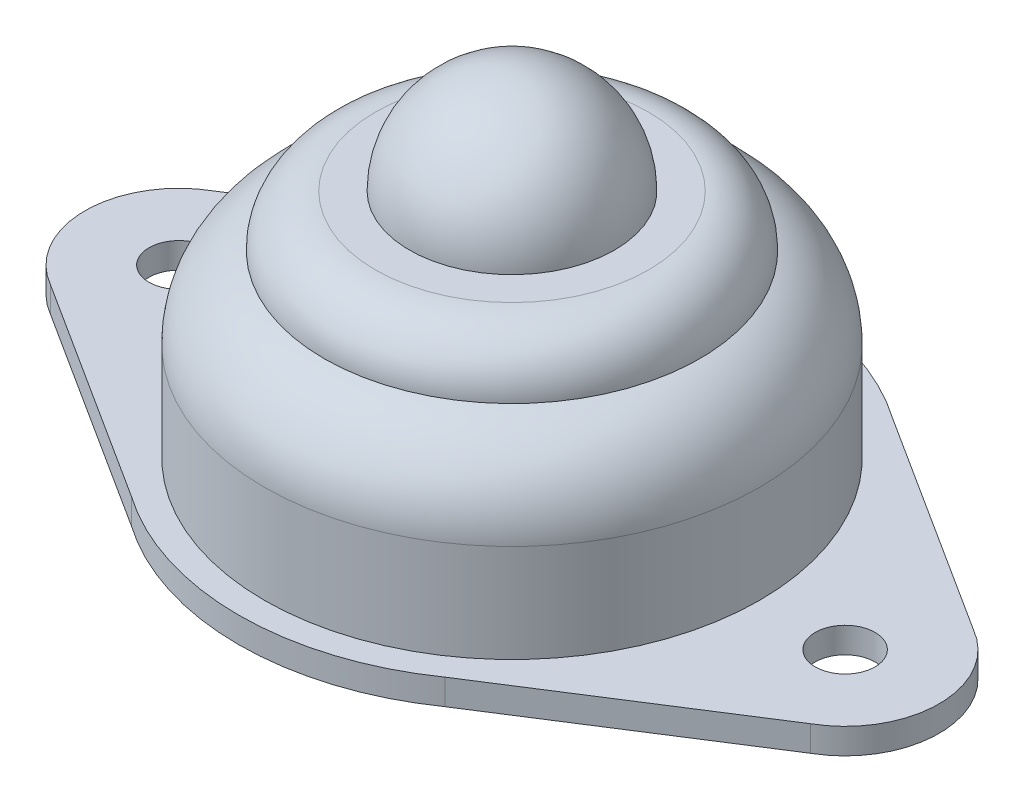
from build123d import *

# Parameters (mm, degrees)
SKETCH1_R           = 1.75
BOSS_EXTRUDE1_DEPTH = 1.5
SKETCH2_R           = 14.5
BOSS_EXTRUDE2_DEPTH = 10.5
SKETCH3_R           = 11
BOSS_EXTRUDE3_DEPTH = 3
FILLET1_R           = 5
FILLET2_R           = 3


# Some blends are built 0.0001 mm under size
with BuildPart() as part:
    # Sketch1 → Boss-Extrude1 (new body)
    with BuildSketch(Plane(origin=(0, 0, 0), x_dir=(1, 0, 0), z_dir=(0, 1, 0))):
        with BuildLine():
            Line((-22.25, -4.763139721), (-9.177222982, -13.106432709))
            ThreePointArc((-9.177222982, -13.106432709), (0, -16), (9.177222982, -13.106432709))
            Line((9.177222982, -13.106432709), (22.25, -4.763139721))
            ThreePointArc((22.25, -4.763139721), (25, 0), (22.25, 4.763139721))
            Line((22.25, 4.763139721), (9.177222982, 13.106432709))
            ThreePointArc((9.177222982, 13.106432709), (0, 16), (-9.177222982, 13.106432709))
            Line((-9.177222982, 13.106432709), (-22.25, 4.763139721))
            ThreePointArc((-22.25, 4.763139721), (-25, 0), (-22.25, -4.763139721))
        make_face()
        with Locations(Location((-19.5, 0, 0), (0, 0, 270))):
            Circle(SKETCH1_R, mode=Mode.SUBTRACT)
        with Locations(Location((19.5, 0, 0), (0, 0, 270))):
            Circle(SKETCH1_R, mode=Mode.SUBTRACT)
    extrude(amount=BOSS_EXTRUDE1_DEPTH)

    # Sketch2 → Boss-Extrude2 (add)
    with BuildSketch(Plane(origin=(0, 1.5, 0), x_dir=(1, 0, 0), z_dir=(0, 1, 0))):
        with Locations(Location((0, 0, 0), (0, 0, 90))):
            Circle(SKETCH2_R)
    extrude(amount=BOSS_EXTRUDE2_DEPTH)

    # Sketch3 → Boss-Extrude3 (add)
    with BuildSketch(Plane(origin=(0, 12, 0), x_dir=(1, 0, 0), z_dir=(0, 1, 0))):
        with Locations(Location((0, 0, 0), (0, 0, 270))):
            Circle(SKETCH3_R)
    extrude(amount=BOSS_EXTRUDE3_DEPTH)

    # Sketch5 → Revolve1 (revolve)
    with BuildSketch(Plane.XY):
        with BuildLine():
            Line((0, 15), (0, 21))
            ThreePointArc((0, 21), (4.242640687, 19.242640687), (6, 15))
            Line((6, 15), (0, 15))
        make_face()
    revolve(axis=Axis((0, 15, 0), (0, 1, 0)))

    # Fillet1
    # the kernel refuses this fillet: 5 mm, written as the material it takes off along each edge
    with BuildSketch(Plane(origin=(0, 12, 0), x_dir=(0, 0, -1), z_dir=(1, 0, 0))) as fillet1_piece_1:
        with BuildLine():
            CenterArc((9.5, -4.769696007), FILLET1_R, 0, 72.542396876)
            Line((11, 0), (11.03, 0.09539392))
            ThreePointArc((11.03, 0.09539392), (12.75, 0.1), (14.5, 0.1))
            Line((14.5, 0.1), (14.6, 0))
            Line((14.6, 0), (14.6, -4.769696007))
            Line((14.6, -4.769696007), (14.5, -4.769696007))
        make_face()
    revolve(axis=Axis((0, 12, 0), (0, 1, 0)), mode=Mode.SUBTRACT)

    # Fillet2
    fillet2_edges = [part.edges().sort_by_distance(p)[0] for p in [
        (0, 15, -11),
    ]]
    fillet(fillet2_edges, radius=FILLET2_R - 0.0001)  # a hair under: the kernel refuses the full size


solid = part.part
